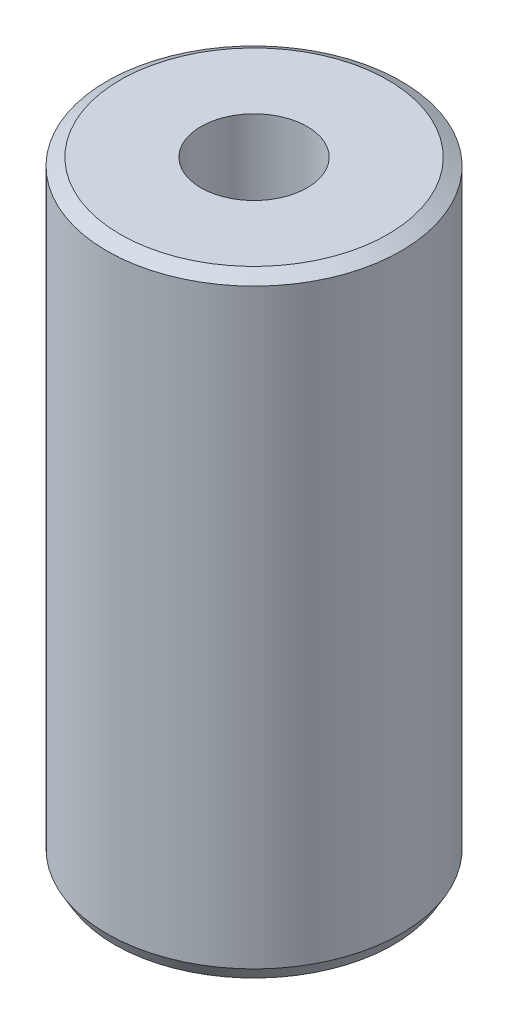
from build123d import *
from OCP.BRepFilletAPI import BRepFilletAPI_MakeChamfer

# Parameters (mm, degrees)
SKETCH1_R           = 17.5
BOSS_EXTRUDE1_DEPTH = 72.839281656
SKETCH2_R           = 6.322199853
CUT_EXTRUDE1_DEPTH  = 77.928934428
CHAMFER1_SIZE       = 0.914708288
CHAMFER1_SIZE2      = 1.584321229


with BuildPart() as part:
    # Sketch1 → Boss-Extrude1 (new body)
    with BuildSketch(Plane(origin=(0, 0, 0), x_dir=(1, 0, 0), z_dir=(0, 1, 0))):
        Circle(SKETCH1_R)
    extrude(amount=BOSS_EXTRUDE1_DEPTH)

    # Sketch2 → Cut-Extrude1 (cut, through all)
    with BuildSketch(Plane(origin=(0, 0, 0), x_dir=(1, 0, 0), z_dir=(0, 1, 0))):
        Circle(SKETCH2_R)
    extrude(amount=CUT_EXTRUDE1_DEPTH, mode=Mode.SUBTRACT)

    # Chamfer1: one chamfer whose edges measure the first distance from different faces: ONE call of the kernel's chamfer builder (chamfer() names one face for all edges)
    chamfer1_edges_1 = [part.edges().sort_by_distance(p)[0] for p in [
        (-17.5, 72.839281656, 0),
    ]]
    chamfer1_side_1 = [part.faces().sort_by_distance(p)[0] for p in [
        (-17.5, 36.419640828, 0),
    ]]
    chamfer1_edges_2 = [part.edges().sort_by_distance(p)[0] for p in [
        (-17.5, 0, 0),
    ]]
    chamfer1_side_2 = [part.faces().sort_by_distance(p)[0] for p in [
        (-17.005025253, 0, 0),
    ]]
    chamfer1 = BRepFilletAPI_MakeChamfer(part.part.solid().wrapped)
    for e in chamfer1_edges_1:
        chamfer1.Add(CHAMFER1_SIZE, CHAMFER1_SIZE2, e.wrapped, chamfer1_side_1[0].wrapped)  # the first distance lies on this face
    for e in chamfer1_edges_2:
        chamfer1.Add(CHAMFER1_SIZE, CHAMFER1_SIZE2, e.wrapped, chamfer1_side_2[0].wrapped)  # the first distance lies on this face
    add(Compound.cast(chamfer1.Shape()), mode=Mode.REPLACE)


solid = part.part
